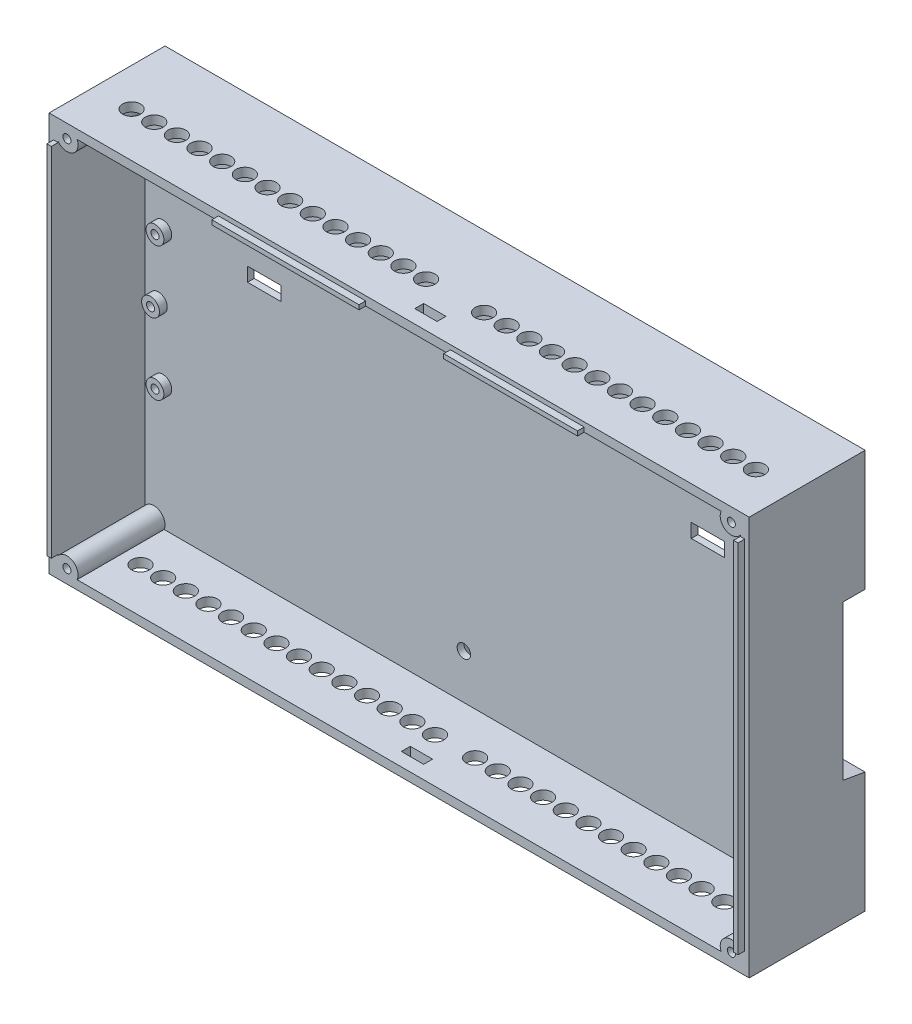
from build123d import *

# Parameters (mm, degrees)
SKETCH1_W           = 157
SKETCH1_H           = 89.5
BOSS_EXTRUDE1_DEPTH = 26
SKETCH2_W           = 153
SKETCH2_H           = 85.5
CUT_EXTRUDE1_DEPTH  = 19.5
SKETCH3_W           = 157
SKETCH3_H           = 35.5
CUT_EXTRUDE2_DEPTH  = 5
SKETCH4_W           = 153
SKETCH4_H           = 23
CUT_EXTRUDE3_DEPTH  = 5
CHAMFER1_SIZE2      = 0.881634904
CHAMFER1_SIZE       = 5
SKETCH5_W           = 17.5
SKETCH5_H           = 23
BOSS_EXTRUDE2_DEPTH = 5
CUT_EXTRUDE4_REACH  = 123.854
SKETCH6_W           = 14.5
SKETCH6_H           = 3
CUT_EXTRUDE5_REACH  = 96.026
SKETCH7_W           = 12
SKETCH7_H           = 13
CHAMFER2_SIZE       = 2
CHAMFER2_SIZE2      = 0.76772807
CHAMFER3_SIZE       = 2
CHAMFER3_SIZE2      = 0.76772807
SKETCH8_R           = 1.5
CUT_EXTRUDE6_DEPTH  = 93.767518561
SKETCH9_W           = 7.5
SKETCH9_H           = 3
BOSS_EXTRUDE3_DEPTH = 3
SKETCH10_W          = 7.5
SKETCH10_H          = 3.136774881
CUT_EXTRUDE7_DEPTH  = 93.767518561
SKETCH11_R          = 1
SKETCH11_W          = 1.5
SKETCH11_H          = 4
BOSS_EXTRUDE4_DEPTH = 3
SKETCH12_R          = 2.5
BOSS_EXTRUDE5_DEPTH = 19.5
SKETCH13_R          = 0.900109386
CUT_EXTRUDE8_DEPTH  = 5
SKETCH14_W          = 1
SKETCH14_H          = 80
BOSS_EXTRUDE6_DEPTH = 1.5
SKETCH15_R          = 2
SKETCH15_R_2        = 0.9
BOSS_EXTRUDE7_DEPTH = 1.75
CUT_EXTRUDE9_REACH  = 124.183
SKETCH16_W          = 5
SKETCH16_H          = 2
CUT_EXTRUDE10_REACH = 124.183
SKETCH17_W          = 5
SKETCH17_H          = 2
SKETCH18_W          = 30
SKETCH18_H          = 1
SKETCH18_W_2        = 33
BOSS_EXTRUDE8_DEPTH = 1.5
SKETCH19_R          = 2
CUT_EXTRUDE11_DEPTH = 2
SKETCH20_R          = 2
CUT_EXTRUDE12_DEPTH = 2


with BuildPart() as part:
    # Sketch1 → Boss-Extrude1 (new body)
    with BuildSketch(Plane.XY):
        Rectangle(SKETCH1_W, SKETCH1_H)
    extrude(amount=BOSS_EXTRUDE1_DEPTH)

    # Sketch2 → Cut-Extrude1 (cut)
    with BuildSketch(Plane.XY.offset(26)):
        Rectangle(SKETCH2_W, SKETCH2_H)
    extrude(amount=-CUT_EXTRUDE1_DEPTH, mode=Mode.SUBTRACT)

    # Sketch3 → Cut-Extrude2 (cut)
    with BuildSketch(Plane(origin=(0, 0, 0), x_dir=(-1, 0, 0), z_dir=(0, 0, -1))):
        Rectangle(SKETCH3_W, SKETCH3_H)
    extrude(amount=-CUT_EXTRUDE2_DEPTH, mode=Mode.SUBTRACT)

    # Sketch4 → Cut-Extrude3 (cut)
    with BuildSketch(Plane(origin=(0, 0, 0), x_dir=(-1, 0, 0), z_dir=(0, 0, -1))):
        with Locations((0, 31.25)):
            Rectangle(SKETCH4_W, SKETCH4_H)
        with Locations((0, -31.25)):
            Rectangle(SKETCH4_W, SKETCH4_H)
    extrude(amount=-CUT_EXTRUDE3_DEPTH, mode=Mode.SUBTRACT)

    # Chamfer1
    chamfer1_edges = [part.edges().sort_by_distance(p)[0] for p in [
        (0, -17.75, 5),
    ]]
    chamfer1_side = [part.faces().sort_by_distance(p)[0] for p in [
        (0, -17.75, 4.982367302),
    ]]
    chamfer(chamfer1_edges, length=CHAMFER1_SIZE - 0.0001, length2=CHAMFER1_SIZE2 - 0.0001, reference=chamfer1_side[0])  # a hair under: the kernel refuses the full size

    # Sketch5 → Boss-Extrude2 (add)
    with BuildSketch(Plane(origin=(0, 0, 5), x_dir=(-1, 0, 0), z_dir=(0, 0, -1))):
        with Locations((0, -31.25)):
            Rectangle(SKETCH5_W, SKETCH5_H)
    extrude(amount=BOSS_EXTRUDE2_DEPTH)

    # Cut-Extrude4: up to this plane
    cut_extrude4_end = Plane(origin=(0, -16.868365096, 5), z_dir=(0, -0.9848077530122075, 0.17364817766693408))
    # Sketch6 → Cut-Extrude4 (cut, up to the surface)
    with BuildSketch(Plane.XZ.offset(44.75), mode=Mode.PRIVATE) as cut_extrude4_sk1:
        with Locations((0, 3.5)):
            Rectangle(SKETCH6_W, SKETCH6_H)
    cut_extrude4_tool1 = split(extrude(cut_extrude4_sk1.sketch, amount=-CUT_EXTRUDE4_REACH, mode=Mode.PRIVATE), bisect_by=cut_extrude4_end, keep=Keep.BOTH, mode=Mode.PRIVATE)
    add(cut_extrude4_tool1.solids().sort_by_distance((0, -44.75, 3.5))[0], mode=Mode.SUBTRACT)

    # Sketch7 → Cut-Extrude5 (cut, up to next)
    with BuildSketch(Plane(origin=(0, 0, 0), x_dir=(-1, 0, 0), z_dir=(0, 0, -1)), mode=Mode.PRIVATE) as cut_extrude5_sk1:
        with Locations((0, -38.25)):
            Rectangle(SKETCH7_W, SKETCH7_H)
    cut_extrude5_tool1 = extrude(cut_extrude5_sk1.sketch, amount=-CUT_EXTRUDE5_REACH, mode=Mode.PRIVATE) & part.part
    add(cut_extrude5_tool1.solids().sort_by_distance((0, -38.25, 0))[0], mode=Mode.SUBTRACT)

    # Chamfer2
    chamfer2_edges = [part.edges().sort_by_distance(p)[0] for p in [
        (6, -44.75, 1),
    ]]
    chamfer2_side = [part.faces().sort_by_distance(p)[0] for p in [
        (6, -38.25, 1),
    ]]
    chamfer(chamfer2_edges, length=CHAMFER2_SIZE, length2=CHAMFER2_SIZE2, reference=chamfer2_side[0])

    # Chamfer3
    chamfer3_edges = [part.edges().sort_by_distance(p)[0] for p in [
        (-6, -44.75, 1),
    ]]
    chamfer3_side = [part.faces().sort_by_distance(p)[0] for p in [
        (-6, -38.25, 1),
    ]]
    chamfer(chamfer3_edges, length=CHAMFER3_SIZE, length2=CHAMFER3_SIZE2, reference=chamfer3_side[0])

    # Sketch8 → Cut-Extrude6 (cut, through all)
    with BuildSketch(Plane(origin=(0, 0, 5), x_dir=(-1, 0, 0), z_dir=(0, 0, -1))):
        with Locations((5, -32.75)):
            Circle(SKETCH8_R)
    extrude(amount=-CUT_EXTRUDE6_DEPTH, mode=Mode.SUBTRACT)

    # Sketch9 → Boss-Extrude3 (add)
    with BuildSketch(Plane.XZ.offset(-17.75)):
        with Locations((49.75, 1.5)):
            Rectangle(SKETCH9_W, SKETCH9_H)
        with Locations((-49.75, 1.5)):
            Rectangle(SKETCH9_W, SKETCH9_H)
    extrude(amount=BOSS_EXTRUDE3_DEPTH)

    # Sketch10 → Cut-Extrude7 (cut, through all)
    with BuildSketch(Plane(origin=(0, 0, 5), x_dir=(-1, 0, 0), z_dir=(0, 0, -1))):
        with Locations((-49.75, 16.181612559)):
            Rectangle(SKETCH10_W, SKETCH10_H)
        with Locations((49.75, 16.181612559)):
            Rectangle(SKETCH10_W, SKETCH10_H)
    extrude(amount=-CUT_EXTRUDE7_DEPTH, mode=Mode.SUBTRACT)

    # Sketch11 → Boss-Extrude4 (add)
    with BuildSketch(Plane(origin=(0, 0, 5), x_dir=(-1, 0, 0), z_dir=(0, 0, -1))):
        with Locations((-28, -22.75)):
            Circle(SKETCH11_R)
        with Locations(Location((28, -22.75, 0), (0, 0, 180))):
            Circle(SKETCH11_R)
        with Locations((-33.25, -21.75)):
            Rectangle(SKETCH11_W, SKETCH11_H)
        with Locations((33.25, -21.75)):
            Rectangle(SKETCH11_W, SKETCH11_H)
    extrude(amount=BOSS_EXTRUDE4_DEPTH)

    # Sketch12 → Boss-Extrude5 (add)
    with BuildSketch(Plane.XY.offset(6.5)):
        with Locations((-74.5, 41.75)):
            Circle(SKETCH12_R)
        with Locations((-74.5, -41.75)):
            Circle(SKETCH12_R)
        with Locations((74.5, -41.75)):
            Circle(SKETCH12_R)
        with Locations((74.5, 41.75)):
            Circle(SKETCH12_R)
    extrude(amount=BOSS_EXTRUDE5_DEPTH)

    # Sketch13 → Cut-Extrude8 (cut)
    with BuildSketch(Plane.XY.offset(26)):
        with Locations((-74.5, 41.75)):
            Circle(SKETCH13_R)
        with Locations(Location((-74.5, -41.75, 0), (0, 0, 180))):
            Circle(SKETCH13_R)
        with Locations((74.5, -41.75)):
            Circle(SKETCH13_R)
        with Locations(Location((74.5, 41.75, 0), (0, 0, 180))):
            Circle(SKETCH13_R)
    extrude(amount=-CUT_EXTRUDE8_DEPTH, mode=Mode.SUBTRACT)

    # Sketch14 → Boss-Extrude6 (add)
    with BuildSketch(Plane.XY.offset(26)):
        with Locations((-77, 0)):
            Rectangle(SKETCH14_W, SKETCH14_H)
        with Locations((77, 0)):
            Rectangle(SKETCH14_W, SKETCH14_H)
    extrude(amount=BOSS_EXTRUDE6_DEPTH)

    # Sketch15 → Boss-Extrude7 (add)
    # profile 1 of 6: a face of its own
    with BuildSketch(Plane.XY.offset(6.5)):
        with Locations((-72.5, -14.75)):
            Circle(SKETCH15_R)
        with Locations((-72.5, -14.75)):
            Circle(SKETCH15_R_2, mode=Mode.SUBTRACT)
    # profile 2 of 6: a face of its own
    with BuildSketch(Plane.XY.offset(6.5)):
        with Locations((-73.5, 0.75)):
            Circle(SKETCH15_R)
        with Locations((-73.5, 0.75)):
            Circle(SKETCH15_R_2, mode=Mode.SUBTRACT)
    # profile 3 of 6: a face of its own
    with BuildSketch(Plane.XY.offset(6.5)):
        with Locations((-72.5, 15.25)):
            Circle(SKETCH15_R)
        with Locations((-72.5, 15.25)):
            Circle(SKETCH15_R_2, mode=Mode.SUBTRACT)
    # profile 4 of 6: a face of its own
    with BuildSketch(Plane.XY.offset(6.5)):
        with Locations(Location((72.5, 15.25, 0), (0, 0, 180))):
            Circle(SKETCH15_R)
        with Locations(Location((72.5, 15.25, 0), (0, 0, 180))):
            Circle(SKETCH15_R_2, mode=Mode.SUBTRACT)
    # profile 5 of 6: a face of its own
    with BuildSketch(Plane.XY.offset(6.5)):
        with Locations(Location((73.5, 0.75, 0), (0, 0, 180))):
            Circle(SKETCH15_R)
        with Locations(Location((73.5, 0.75, 0), (0, 0, 180))):
            Circle(SKETCH15_R_2, mode=Mode.SUBTRACT)
    # profile 6 of 6: a face of its own
    with BuildSketch(Plane.XY.offset(6.5)):
        with Locations(Location((72.5, -14.75, 0), (0, 0, 180))):
            Circle(SKETCH15_R)
        with Locations(Location((72.5, -14.75, 0), (0, 0, 180))):
            Circle(SKETCH15_R_2, mode=Mode.SUBTRACT)
    extrude(amount=BOSS_EXTRUDE7_DEPTH)

    # Sketch16 → Cut-Extrude9 (cut, up to next)
    with BuildSketch(Plane(origin=(0, -44.75, 0), x_dir=(-1, 0, 0), z_dir=(0, -1, 0)), mode=Mode.PRIVATE) as cut_extrude9_sk1:
        with Locations((0, -22)):
            Rectangle(SKETCH16_W, SKETCH16_H)
    cut_extrude9_tool1 = extrude(cut_extrude9_sk1.sketch, amount=-CUT_EXTRUDE9_REACH, mode=Mode.PRIVATE) & part.part
    add(cut_extrude9_tool1.solids().sort_by_distance((0, -44.75, 22))[0], mode=Mode.SUBTRACT)

    # Sketch17 → Cut-Extrude10 (cut, up to next)
    with BuildSketch(Plane(origin=(0, 44.75, 0), x_dir=(1, 0, 0), z_dir=(0, 1, 0)), mode=Mode.PRIVATE) as cut_extrude10_sk1:
        with Locations((3, -22)):
            Rectangle(SKETCH17_W, SKETCH17_H)
    cut_extrude10_tool1 = extrude(cut_extrude10_sk1.sketch, amount=-CUT_EXTRUDE10_REACH, mode=Mode.PRIVATE) & part.part
    add(cut_extrude10_tool1.solids().sort_by_distance((3, 44.75, 22))[0], mode=Mode.SUBTRACT)

    # Sketch18 → Boss-Extrude8 (add)
    with BuildSketch(Plane.XY.offset(26)):
        with Locations((26.5, 43.25)):
            Rectangle(SKETCH18_W, SKETCH18_H)
        with Locations((-24, 43.25)):
            Rectangle(SKETCH18_W_2, SKETCH18_H)
    extrude(amount=BOSS_EXTRUDE8_DEPTH)

    # Sketch19 → Cut-Extrude11 (cut)
    with BuildSketch(Plane.XZ.offset(44.75)):
        with Locations(Location((-68, 16, 0), (0, 0, 270))):
            Circle(SKETCH19_R)
        with Locations(Location((-62.92, 16, 0), (0, 0, 270))):
            Circle(SKETCH19_R)
        with Locations(Location((-57.84, 16, 0), (0, 0, 270))):
            Circle(SKETCH19_R)
        with Locations(Location((-52.76, 16, 0), (0, 0, 270))):
            Circle(SKETCH19_R)
        with Locations(Location((-47.68, 16, 0), (0, 0, 270))):
            Circle(SKETCH19_R)
        with Locations(Location((-42.6, 16, 0), (0, 0, 270))):
            Circle(SKETCH19_R)
        with Locations(Location((-37.52, 16, 0), (0, 0, 270))):
            Circle(SKETCH19_R)
        with Locations(Location((-32.44, 16, 0), (0, 0, 270))):
            Circle(SKETCH19_R)
        with Locations(Location((-27.36, 16, 0), (0, 0, 270))):
            Circle(SKETCH19_R)
        with Locations(Location((-22.28, 16, 0), (0, 0, 270))):
            Circle(SKETCH19_R)
        with Locations(Location((-17.2, 16, 0), (0, 0, 270))):
            Circle(SKETCH19_R)
        with Locations(Location((-12.12, 16, 0), (0, 0, 270))):
            Circle(SKETCH19_R)
        with Locations(Location((-7.04, 16, 0), (0, 0, 270))):
            Circle(SKETCH19_R)
        with Locations(Location((-1.96, 16, 0), (0, 0, 270))):
            Circle(SKETCH19_R)
        with Locations(Location((68, 16, 0), (0, 0, 270))):
            Circle(SKETCH19_R)
        with Locations(Location((62.92, 16, 0), (0, 0, 270))):
            Circle(SKETCH19_R)
        with Locations(Location((57.84, 16, 0), (0, 0, 270))):
            Circle(SKETCH19_R)
        with Locations(Location((52.76, 16, 0), (0, 0, 270))):
            Circle(SKETCH19_R)
        with Locations(Location((47.68, 16, 0), (0, 0, 270))):
            Circle(SKETCH19_R)
        with Locations(Location((42.6, 16, 0), (0, 0, 270))):
            Circle(SKETCH19_R)
        with Locations(Location((37.52, 16, 0), (0, 0, 270))):
            Circle(SKETCH19_R)
        with Locations(Location((32.44, 16, 0), (0, 0, 270))):
            Circle(SKETCH19_R)
        with Locations(Location((27.36, 16, 0), (0, 0, 270))):
            Circle(SKETCH19_R)
        with Locations(Location((22.28, 16, 0), (0, 0, 270))):
            Circle(SKETCH19_R)
        with Locations(Location((17.2, 16, 0), (0, 0, 270))):
            Circle(SKETCH19_R)
        with Locations(Location((12.12, 16, 0), (0, 0, 270))):
            Circle(SKETCH19_R)
        with Locations(Location((7.04, 16, 0), (0, 0, 270))):
            Circle(SKETCH19_R)
    extrude(amount=-CUT_EXTRUDE11_DEPTH, mode=Mode.SUBTRACT)

    # Sketch20 → Cut-Extrude12 (cut)
    with BuildSketch(Plane(origin=(0, 44.75, 0), x_dir=(1, 0, 0), z_dir=(0, 1, 0))):
        with Locations(Location((-70, -16, 0), (0, 0, 270))):
            Circle(SKETCH20_R)
        with Locations(Location((-64.92, -16, 0), (0, 0, 270))):
            Circle(SKETCH20_R)
        with Locations(Location((-59.84, -16, 0), (0, 0, 270))):
            Circle(SKETCH20_R)
        with Locations(Location((-54.76, -16, 0), (0, 0, 270))):
            Circle(SKETCH20_R)
        with Locations(Location((-49.68, -16, 0), (0, 0, 270))):
            Circle(SKETCH20_R)
        with Locations(Location((-44.6, -16, 0), (0, 0, 270))):
            Circle(SKETCH20_R)
        with Locations(Location((-39.52, -16, 0), (0, 0, 270))):
            Circle(SKETCH20_R)
        with Locations(Location((-34.44, -16, 0), (0, 0, 270))):
            Circle(SKETCH20_R)
        with Locations(Location((-29.36, -16, 0), (0, 0, 270))):
            Circle(SKETCH20_R)
        with Locations(Location((-24.28, -16, 0), (0, 0, 270))):
            Circle(SKETCH20_R)
        with Locations(Location((-19.2, -16, 0), (0, 0, 270))):
            Circle(SKETCH20_R)
        with Locations(Location((-14.12, -16, 0), (0, 0, 270))):
            Circle(SKETCH20_R)
        with Locations(Location((-9.04, -16, 0), (0, 0, 270))):
            Circle(SKETCH20_R)
        with Locations(Location((-3.96, -16, 0), (0, 0, 270))):
            Circle(SKETCH20_R)
        with Locations(Location((70, -16, 0), (0, 0, 270))):
            Circle(SKETCH20_R)
        with Locations(Location((64.92, -16, 0), (0, 0, 270))):
            Circle(SKETCH20_R)
        with Locations(Location((59.84, -16, 0), (0, 0, 270))):
            Circle(SKETCH20_R)
        with Locations(Location((54.76, -16, 0), (0, 0, 270))):
            Circle(SKETCH20_R)
        with Locations(Location((49.68, -16, 0), (0, 0, 270))):
            Circle(SKETCH20_R)
        with Locations(Location((44.6, -16, 0), (0, 0, 270))):
            Circle(SKETCH20_R)
        with Locations(Location((39.52, -16, 0), (0, 0, 270))):
            Circle(SKETCH20_R)
        with Locations(Location((34.44, -16, 0), (0, 0, 270))):
            Circle(SKETCH20_R)
        with Locations(Location((29.36, -16, 0), (0, 0, 270))):
            Circle(SKETCH20_R)
        with Locations(Location((24.28, -16, 0), (0, 0, 270))):
            Circle(SKETCH20_R)
        with Locations(Location((19.2, -16, 0), (0, 0, 270))):
            Circle(SKETCH20_R)
        with Locations(Location((14.12, -16, 0), (0, 0, 270))):
            Circle(SKETCH20_R)
        with Locations(Location((9.04, -16, 0), (0, 0, 270))):
            Circle(SKETCH20_R)
    extrude(amount=-CUT_EXTRUDE12_DEPTH, mode=Mode.SUBTRACT)


solid = part.part
